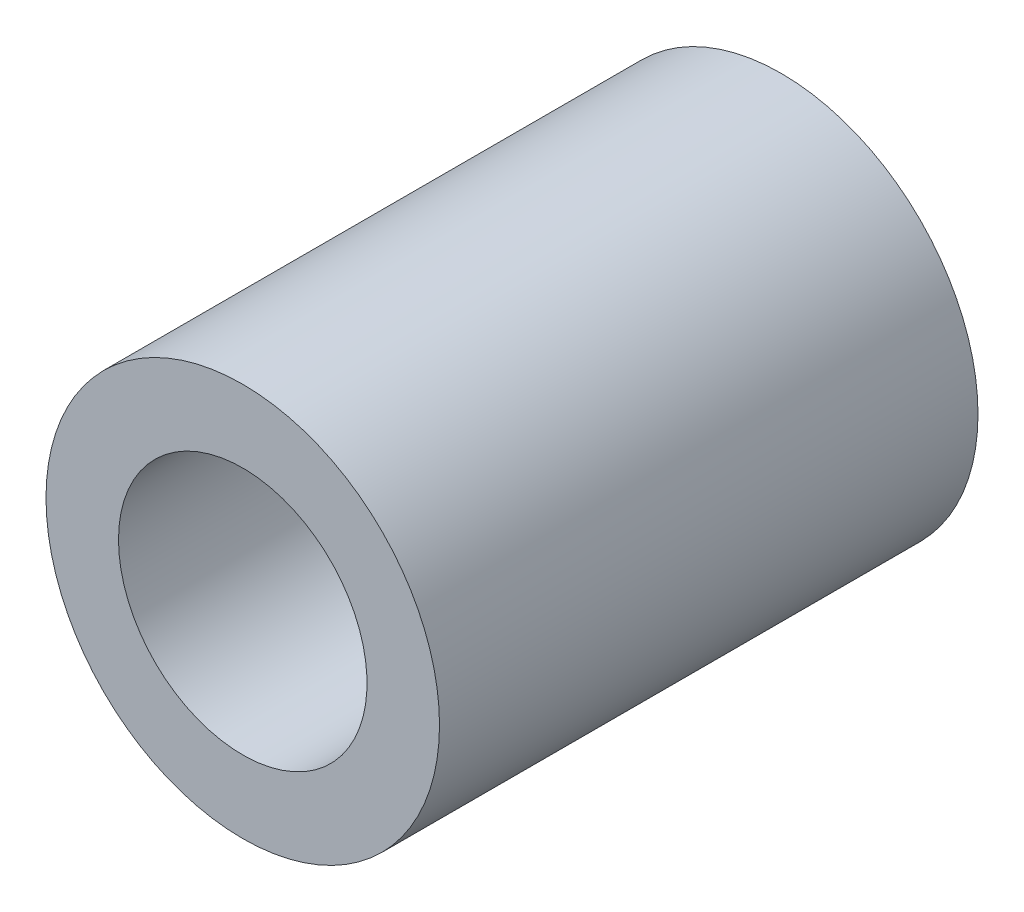
from build123d import *

# Parameters (mm, degrees)
CROQUIS1_R              = 4.75
CROQUIS1_R_2            = 3
SALIENTE_EXTRUIR1_DEPTH = 13


with BuildPart() as part:
    # Croquis1 → Saliente-Extruir1 (new body)
    with BuildSketch(Plane.XY):
        Circle(CROQUIS1_R)
        Circle(CROQUIS1_R_2, mode=Mode.SUBTRACT)
    extrude(amount=SALIENTE_EXTRUIR1_DEPTH)


solid = part.part
